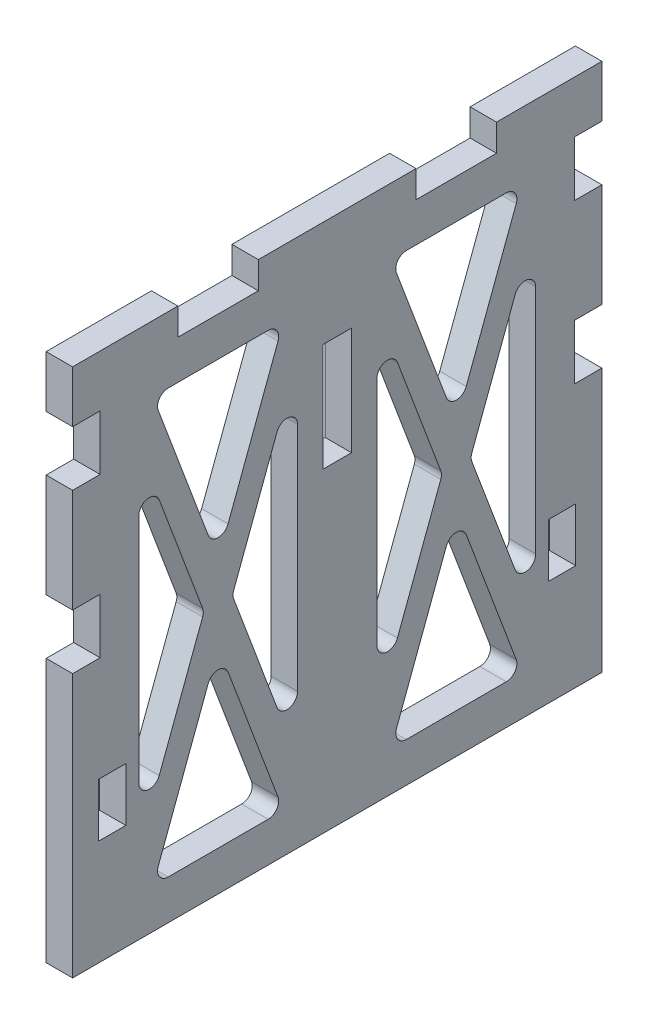
from build123d import *

# Parameters (mm, degrees)
SKETCH4_W           = 6.5024
SKETCH4_H           = 12.8524
SKETCH4_W_2         = 6.858
SKETCH4_H_2         = 25.908
BOSS_EXTRUDE1_DEPTH = 6.35
CUT_EXTRUDE1_DEPTH  = 143.132235964
FILLET1_R           = 2.54


with BuildPart() as part:
    # Sketch4 → Boss-Extrude1 (new body)
    with BuildSketch(Plane(origin=(0, 0, 0), x_dir=(0, 0, -1), z_dir=(1, 0, 0))):
        Polygon((-63.5, 0), (-3.175, 0), (3.175, 0), (63.5, 0), (63.5, 32.004), (63.5, 44.704), (63.5, 63.246), (56.896, 63.246), (56.896, 76.454), (63.5, 76.454), (63.5, 101.346), (56.896, 101.346), (56.896, 114.554), (63.5, 114.554), (63.5, 127), (38.227, 127), (38.227, 120.523), (18.923, 120.523), (18.923, 127), (-18.923, 127), (-18.923, 120.523), (-38.227, 120.523), (-38.227, 127), (-63.5, 127), (-63.5, 114.554), (-56.896, 114.554), (-56.896, 101.346), (-63.5, 101.346), (-63.5, 76.454), (-56.896, 76.454), (-56.896, 63.246), (-63.5, 63.246), (-63.5, 38.354), (-63.5, 25.654), align=None)
        with Locations((-53.975, 31.75)):
            Rectangle(SKETCH4_W, SKETCH4_H, mode=Mode.SUBTRACT)
        with Locations((53.975, 31.75)):
            Rectangle(SKETCH4_W, SKETCH4_H, mode=Mode.SUBTRACT)
        with Locations((0, 88.646)):
            Rectangle(SKETCH4_W_2, SKETCH4_H_2, mode=Mode.SUBTRACT)
    extrude(amount=BOSS_EXTRUDE1_DEPTH)

    # Sketch5 → Cut-Extrude1 (cut, through all)
    with BuildSketch(Plane(origin=(6.35, 0, 0), x_dir=(0, 0, -1), z_dir=(1, 0, 0))):
        Polygon((-12.915901486, 111.125), (-44.234098514, 111.125), (-28.575, 69.367403964), align=None)
        Polygon((-31.965901486, 60.325), (-47.625, 102.082596036), (-47.625, 18.567403964), align=None)
        Polygon((-9.525, 102.082596036), (-25.184098514, 60.325), (-9.525, 18.567403964), align=None)
        Polygon((-12.915901486, 9.525), (-28.575, 51.282596036), (-44.234098514, 9.525), align=None)
        Polygon((44.234098514, 111.125), (12.915901486, 111.125), (28.575, 69.367403964), align=None)
        Polygon((25.184098514, 60.325), (9.525, 102.082596036), (9.525, 18.567403964), align=None)
        Polygon((47.625, 102.082596036), (31.965901486, 60.325), (47.625, 18.567403964), align=None)
        Polygon((44.234098514, 9.525), (28.575, 51.282596036), (12.915901486, 9.525), align=None)
    extrude(amount=-CUT_EXTRUDE1_DEPTH, mode=Mode.SUBTRACT)

    # Fillet1
    fillet1_edges = [part.edges().sort_by_distance(p)[0] for p in [
        (3.175, 51.282596036, 28.575),
        (3.175, 9.525, 12.915901486),
        (3.175, 9.525, 44.234098514),
        (3.175, 102.082596036, 9.525),
        (3.175, 18.567403964, 9.525),
        (3.175, 60.325, 25.184098514),
        (3.175, 51.282596036, -28.575),
        (3.175, 9.525, -44.234098514),
        (3.175, 9.525, -12.915901486),
        (3.175, 60.325, -31.965901486),
        (3.175, 102.082596036, -47.625),
        (3.175, 18.567403964, -47.625),
        (3.175, 60.325, 31.965901486),
        (3.175, 18.567403964, 47.625),
        (3.175, 102.082596036, 47.625),
        (3.175, 111.125, -12.915901486),
        (3.175, 111.125, -44.234098514),
        (3.175, 69.367403964, -28.575),
        (3.175, 111.125, 12.915901486),
        (3.175, 69.367403964, 28.575),
        (3.175, 102.082596036, -9.525),
        (3.175, 60.325, -25.184098514),
        (3.175, 18.567403964, -9.525),
        (3.175, 111.125, 44.234098514),
    ]]
    fillet(fillet1_edges, radius=FILLET1_R)


solid = part.part
